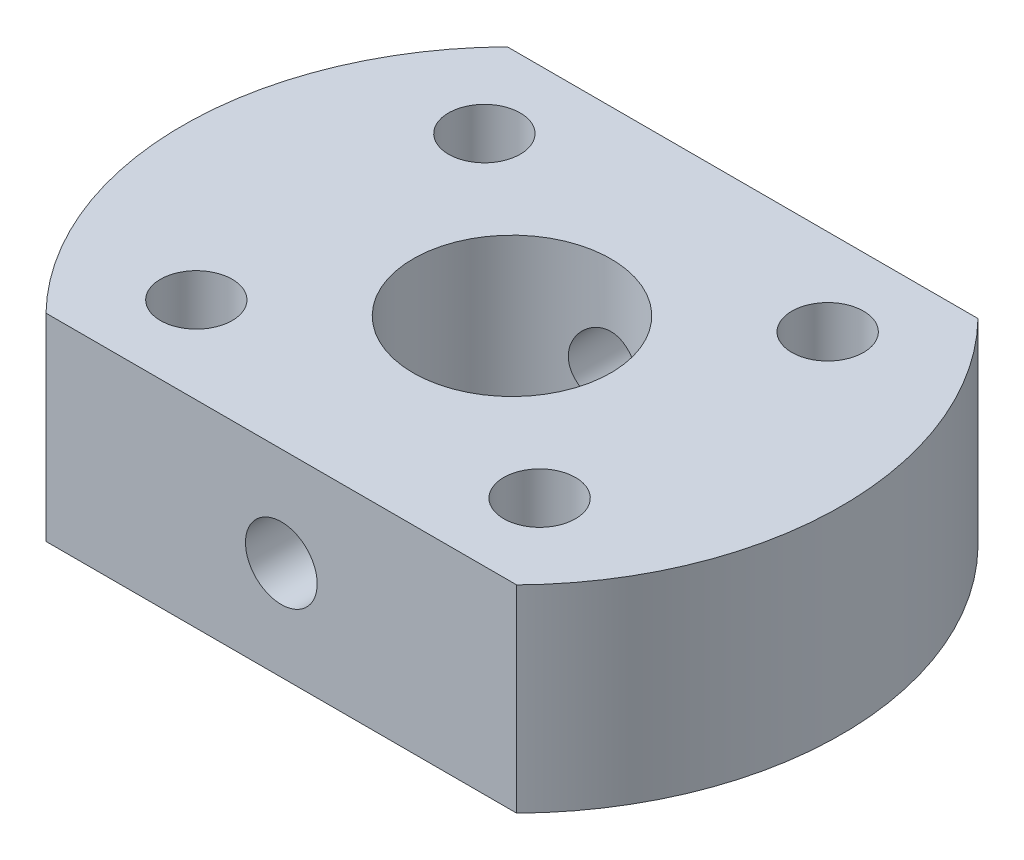
from build123d import *

# Parameters (mm, degrees)
SKETCH1_R               = 15.875
SKETCH1_R_2             = 4.7625
BOSS_EXTRUDE1_DEPTH     = 4.7625
CUT_EXTRUDE1_DEPTH      = 25.387637749
SKETCH3_R               = 1.7272
CUT_EXTRUDE2_DEPTH      = 8.255
SKETCH4_R               = 1.7272
CUT_EXTRUDE3_DEPTH      = 28.7244956
MIRROR2_COPY_1_SKETCH_R = 1.7272
MIRROR2_COPY_1_DEPTH    = 8.255
MIRROR2_COPY_2_SKETCH_R = 1.7272
MIRROR2_COPY_2_DEPTH    = 8.255


with BuildPart() as part:
    # Sketch1 → Boss-Extrude1 (new, symmetric)
    with BuildSketch(Plane(origin=(0, 0, 0), x_dir=(1, 0, 0), z_dir=(0, 1, 0))):
        Circle(SKETCH1_R)
        Circle(SKETCH1_R_2, mode=Mode.SUBTRACT)
    extrude(amount=BOSS_EXTRUDE1_DEPTH, both=True)

    # Sketch2 → Cut-Extrude1 (cut, through all)
    with BuildSketch(Plane(origin=(0, 4.7625, 0), x_dir=(1, 0, 0), z_dir=(0, 1, 0))):
        with BuildLine():
            Line((-11.33701763, 11.1125), (11.33701763, 11.1125))
            ThreePointArc((11.33701763, 11.1125), (0, 15.875), (-11.33701763, 11.1125))
        make_face()
        with BuildLine():
            Line((-11.33701763, -11.1125), (11.33701763, -11.1125))
            ThreePointArc((11.33701763, -11.1125), (0, -15.875), (-11.33701763, -11.1125))
        make_face()
    extrude(amount=-CUT_EXTRUDE1_DEPTH, mode=Mode.SUBTRACT)

    # Sketch3 → Cut-Extrude2 (cut)
    with BuildSketch(Plane(origin=(0, 4.7625, 0), x_dir=(1, 0, 0), z_dir=(0, 1, 0))):
        with Locations((-8.269449763, 6.938892247)):
            Circle(SKETCH3_R)
    cut_extrude2 = extrude(amount=-CUT_EXTRUDE2_DEPTH, mode=Mode.SUBTRACT)

    # Sketch4 → Cut-Extrude3 (cut, through all)
    with BuildSketch(Plane.XY.offset(11.1125)):
        Circle(SKETCH4_R)
    extrude(amount=-CUT_EXTRUDE3_DEPTH, mode=Mode.SUBTRACT)

    # Mirror1: Cut-Extrude2 across plane
    add(cut_extrude2.mirror(Plane.XY), mode=Mode.SUBTRACT)

    # Mirror2 copy 1 sketch → Mirror2 copy 1 (cut)
    with BuildSketch(Plane(origin=(0, 4.7625, 0), x_dir=(-1, 0, 0), z_dir=(0, 1, 0))):
        with Locations((-8.269449763, 6.938892247)):
            Circle(MIRROR2_COPY_1_SKETCH_R)
    extrude(amount=-MIRROR2_COPY_1_DEPTH, mode=Mode.SUBTRACT)

    # Mirror2 copy 2 sketch → Mirror2 copy 2 (cut)
    with BuildSketch(Plane(origin=(0, 4.7625, 0), x_dir=(-1, 0, 0), z_dir=(0, 1, 0))):
        with Locations((-8.269449763, -6.938892247)):
            Circle(MIRROR2_COPY_2_SKETCH_R)
    extrude(amount=-MIRROR2_COPY_2_DEPTH, mode=Mode.SUBTRACT)


solid = part.part
